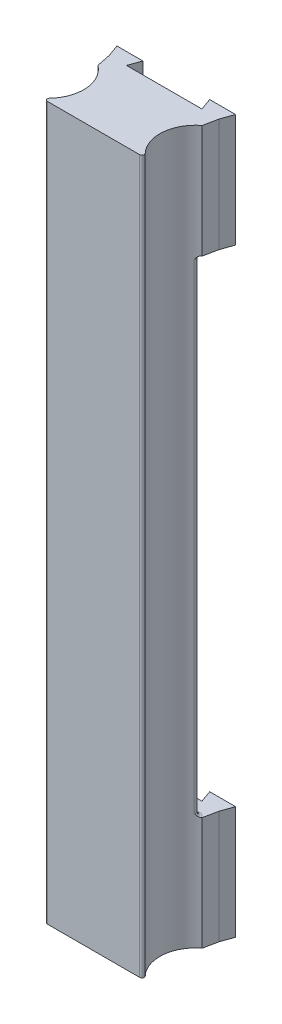
from build123d import *

# Parameters (mm, degrees)
BOSS_EXTRUDE2_DEPTH     = 31.5
CUT_EXTRUDE1_DEPTH      = 33.294824363
CUT_EXTRUDE1_DEPTH_BACK = 33.294824363
SKETCH2_W               = 2.315915901
SKETCH2_H               = 43
CUT_EXTRUDE2_START      = -21.5
CUT_EXTRUDE2_DEPTH      = 43
FILLET1_R               = 0.3


with BuildPart() as part:
    # Sketch1 → Boss-Extrude2 (new, symmetric)
    with BuildSketch(Plane(origin=(0, 0, 0), x_dir=(1, 0, 0), z_dir=(0, 1, 0))):
        with BuildLine():
            Line((-4.085, -2.5), (4.085, -2.5))
            ThreePointArc((4.085, -2.5), (4.268829006, -2.37878386), (4.229827586, -2.162068966))
            ThreePointArc((4.229827586, -2.162068966), (3.375283995, 0.253722072), (4.608380324, 2.5))
            Line((4.608380324, 2.5), (4.864564522, 3.75))
            Line((4.864564522, 3.75), (5.245248772, 4.815915901))
            Line((5.245248772, 4.815915901), (2.954751228, 4.815915901))
            Line((2.954751228, 4.815915901), (3.335435478, 3.75))
            Line((3.335435478, 3.75), (-3.335435478, 3.75))
            Line((-3.335435478, 3.75), (-2.954751228, 4.815915901))
            Line((-2.954751228, 4.815915901), (-5.245248772, 4.815915901))
            Line((-5.245248772, 4.815915901), (-4.864564522, 3.75))
            Line((-4.864564522, 3.75), (-4.608380324, 2.5))
            ThreePointArc((-4.608380324, 2.5), (-3.375283995, 0.253722072), (-4.229827586, -2.162068966))
            ThreePointArc((-4.229827586, -2.162068966), (-4.268829006, -2.37878386), (-4.085, -2.5))
        make_face()
    extrude(amount=BOSS_EXTRUDE2_DEPTH, both=True)

    # Sketch2 → Cut-Extrude1 (cut, two sides: drawn at the far end of the back side and taken through both)
    with BuildSketch(Plane(origin=(0, 0, 0), x_dir=(0, 0, -1), z_dir=(1, 0, 0)).offset(-CUT_EXTRUDE1_DEPTH_BACK)):
        with Locations((3.657957951, 0)):
            Rectangle(SKETCH2_W, SKETCH2_H)
    extrude(amount=CUT_EXTRUDE1_DEPTH + CUT_EXTRUDE1_DEPTH_BACK, mode=Mode.SUBTRACT)

    # Sketch3 → Cut-Extrude2 (cut)
    with BuildSketch(Plane(origin=(0, 0, 0), x_dir=(1, 0, 0), z_dir=(0, 1, 0)).offset(CUT_EXTRUDE2_START)):
        with BuildLine():
            Line((4.608380324, 2.5), (4.085, 2.5))
            ThreePointArc((4.085, 2.5), (4.268829006, 2.37878386), (4.229827586, 2.162068966))
            ThreePointArc((4.229827586, 2.162068966), (4.412255357, 2.338706331), (4.608380324, 2.5))
        make_face()
        with BuildLine():
            Line((-4.085, 2.5), (-4.608380324, 2.5))
            ThreePointArc((-4.608380324, 2.5), (-4.412255357, 2.338706331), (-4.229827586, 2.162068966))
            ThreePointArc((-4.229827586, 2.162068966), (-4.268829006, 2.37878386), (-4.085, 2.5))
        make_face()
    extrude(amount=CUT_EXTRUDE2_DEPTH, mode=Mode.SUBTRACT)

    # Fillet1
    # the kernel refuses this fillet: 0.3 mm, written as the material it adds along each edge
    with BuildSketch(Plane(origin=(-4.085, 21.5, -2.5), x_dir=(0, 0, -1), z_dir=(1, 0, 0))) as fillet1_piece_1:
        with BuildLine():
            CenterArc((FILLET1_R, -FILLET1_R), FILLET1_R, 90, 90)
            Line((0, -FILLET1_R), (0, 0))
            Line((0, 0), (FILLET1_R, 0))
        make_face()
    extrude(amount=8.17)
    with BuildSketch(Plane(origin=(-4.085, -21.5, -2.5), x_dir=(0, 0, -1), z_dir=(1, 0, 0))) as fillet1_piece_2:
        with BuildLine():
            CenterArc((FILLET1_R, FILLET1_R), FILLET1_R, 180, 90)
            Line((0, FILLET1_R), (0, 0))
            Line((0, 0), (FILLET1_R, 0))
        make_face()
    extrude(amount=8.17)
    with BuildSketch(Plane(origin=(4.085, -21.5, -2.3), x_dir=(0, 0, -1), z_dir=(-1, 0, 0))) as fillet1_piece_3_section:
        with BuildLine():
            CenterArc((0.2 + FILLET1_R, -FILLET1_R), FILLET1_R, 90, 90)
            Line((0.2 + FILLET1_R, 0), (0.2, 0))
            Line((0.2, 0), (0.2, -FILLET1_R))
        make_face()
    fillet1_piece_3 = revolve(axis=Axis((4.085, -21.5, -2.3), (0, -1, 0)), revolution_arc=348.652256653, mode=Mode.PRIVATE)
    fillet1_piece_3 = fillet1_piece_3 - Plane(origin=(6.5, -21.422221686, 0), x_dir=(-0.7241379310344833, 0, 0.6896551724137925), z_dir=(0, 1, 0)) * Cylinder(3.135, 3, mode=Mode.PRIVATE)
    add(fillet1_piece_3)
    with BuildSketch(Plane(origin=(4.085, 21.5, -2.3), x_dir=(0, 0, -1), z_dir=(-1, 0, 0))) as fillet1_piece_4_section:
        with BuildLine():
            CenterArc((0.2 + FILLET1_R, FILLET1_R), FILLET1_R, 180, 90)
            Line((0.2, FILLET1_R), (0.2, 0))
            Line((0.2, 0), (0.2 + FILLET1_R, 0))
        make_face()
    fillet1_piece_4 = revolve(axis=Axis((4.085, 21.5, -2.3), (0, -1, 0)), revolution_arc=348.652256653, mode=Mode.PRIVATE)
    fillet1_piece_4 = fillet1_piece_4 - Plane(origin=(6.5, 21.453136738, 0), x_dir=(-0.7241379310344833, 0, 0.6896551724137925), z_dir=(0, 1, 0)) * Cylinder(3.135, 3, mode=Mode.PRIVATE)
    add(fillet1_piece_4)
    with BuildSketch(Plane(origin=(-4.085, -21.5, -2.3), x_dir=(0.19676320132500988, 0, -0.9804510403912751), z_dir=(-0.9804510403912751, 0, -0.19676320132500988))) as fillet1_piece_5_section:
        with BuildLine():
            CenterArc((-0.2 - FILLET1_R, -FILLET1_R), FILLET1_R, 0, 90)
            Line((-0.2, -FILLET1_R), (-0.2, 0))
            Line((-0.2, 0), (-0.2 - FILLET1_R, 0))
        make_face()
    fillet1_piece_5 = revolve(axis=Axis((-4.085, -21.5, -2.3), (0, -1, 0)), revolution_arc=348.652256653, mode=Mode.PRIVATE)
    fillet1_piece_5 = fillet1_piece_5 - Plane(origin=(-6.5, -21.422220157, 0), x_dir=(0.6033874565748113, 0, -0.7974481658692183), z_dir=(0, 1, 0)) * Cylinder(3.135, 2, mode=Mode.PRIVATE)
    add(fillet1_piece_5)
    with BuildSketch(Plane(origin=(-4.085, 21.5, -2.3), x_dir=(0.1967632013250235, 0, -0.9804510403912723), z_dir=(-0.9804510403912723, 0, -0.1967632013250235))) as fillet1_piece_6_section:
        with BuildLine():
            CenterArc((-0.2 - FILLET1_R, FILLET1_R), FILLET1_R, 270, 90)
            Line((-0.2, FILLET1_R), (-0.2, 0))
            Line((-0.2, 0), (-0.2 - FILLET1_R, 0))
        make_face()
    fillet1_piece_6 = revolve(axis=Axis((-4.085, 21.5, -2.3), (0, -1, 0)), revolution_arc=348.652256653, mode=Mode.PRIVATE)
    fillet1_piece_6 = fillet1_piece_6 - Plane(origin=(-6.5, 21.422220134, 0), x_dir=(0.6033874565748113, 0, -0.7974481658692183), z_dir=(0, 1, 0)) * Cylinder(3.135, 2, mode=Mode.PRIVATE)
    add(fillet1_piece_6)


solid = part.part
